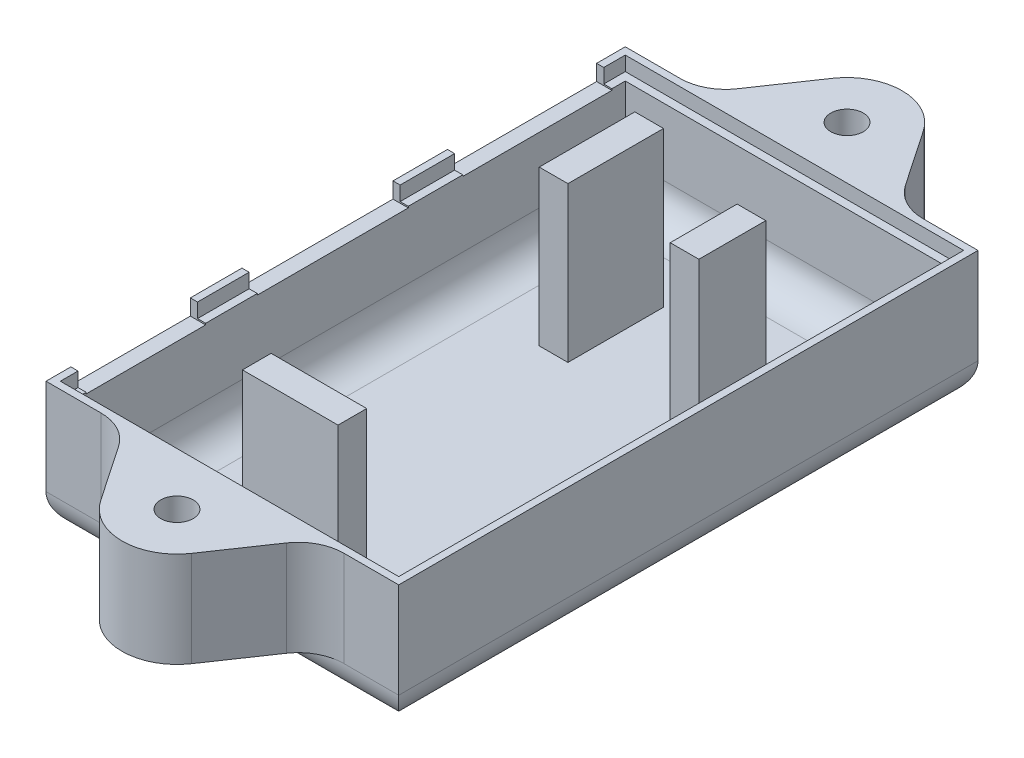
from build123d import *

# Parameters (mm, degrees)
SKETCH_2_W                  = 36.9
SKETCH_2_H                  = 60.6
SKETCH_2_W_2                = 33.7
SKETCH_2_H_2                = 57.4
SKETCH_2_W_3                = 35.4
SKETCH_2_H_3                = 59.1
SKETCH_2_R                  = 3.75
SKETCH_2_R_2                = 2.25
SKETCH_2_R_3                = 0.75
EXTRUDE_1_DEPTH             = 1.5
EXTRUDE_START               = 1.5
SKETCH_2_20_W               = 36.9
SKETCH_2_20_H               = 60.6
SKETCH_2_20_W_2             = 35.4
SKETCH_2_20_H_2             = 59.1
SKETCH_2_20_W_3             = 33.7
SKETCH_2_20_H_3             = 57.4
EXTRUDE_9_DEPTH             = 12
CUT_EXTRUDE_START           = 13.5
SKETCH_2_21_W               = 35.4
SKETCH_2_21_H               = 59.1
SKETCH_2_21_W_2             = 33.7
SKETCH_2_21_H_2             = 57.4
CUT_EXTRUDE_3_DEPTH         = 1.5
EXTRUDE_START_2             = 13.5
SKETCH_2_23_R               = 3
SKETCH_2_23_R_2             = 1.6
EXTRUDE_10_DEPTH            = 10
FILLET_2_R                  = 3.5
HOLE_WIZARD_M32_D           = 3.4
HOLE_WIZARD_M32_CSINK_D     = 6.72
HOLE_WIZARD_M32_CSINK_ANGLE = 90
SKETCH_12_W                 = 1.6
SKETCH_12_H                 = 15.6
SKETCH_12_H_2               = 15.8
SKETCH_12_H_3               = 12.5
CUT_EXTRUDE_4_DEPTH         = 1.65
SKETCH_13_W                 = 3
SKETCH_13_H                 = 10
SKETCH_13_H_2               = 7
SKETCH_13_W_2               = 10
SKETCH_13_H_3               = 3
EXTRUDE_11_DEPTH            = 16.2


with BuildPart() as part:
    # Эскиз2 → Бобышка-Вытянуть1 (new body)
    # profile 1 of 15: a face of its own
    with BuildSketch(Plane(origin=(0, 0, 0), x_dir=(1, 0, 0), z_dir=(0, 1, 0))):
        with Locations((16.65, 28.5)):
            Rectangle(SKETCH_2_W, SKETCH_2_H)
        with Locations((16.65, 28.5)):
            Rectangle(SKETCH_2_W_2, SKETCH_2_H_2, mode=Mode.SUBTRACT)
    # profile 2 of 15: a face of its own
    with BuildSketch(Plane(origin=(0, 0, 0), x_dir=(1, 0, 0), z_dir=(0, 1, 0))):
        with Locations((16.65, 28.5)):
            Rectangle(SKETCH_2_W_3, SKETCH_2_H_3)
        with Locations((16.65, 28.5)):
            Rectangle(SKETCH_2_W_2, SKETCH_2_H_2, mode=Mode.SUBTRACT)
    # profile 3 of 15: a face of its own
    with BuildSketch(Plane(origin=(0, 0, 0), x_dir=(1, 0, 0), z_dir=(0, 1, 0))):
        with BuildLine():
            Line((-0.2, 57.2), (-0.2, -0.2))
            Line((-0.2, -0.2), (33.5, -0.2))
            Line((33.5, -0.2), (33.5, 10.050490243))
            ThreePointArc((33.5, 10.050490243), (27, 12.6), (33.5, 15.149509757))
            Line((33.5, 15.149509757), (33.5, 57.2))
            Line((33.5, 57.2), (-0.2, 57.2))
        make_face()
        with Locations((5.1, 19.73)):
            Circle(SKETCH_2_R, mode=Mode.SUBTRACT)
        with Locations((5.1, 41.13)):
            Circle(SKETCH_2_R, mode=Mode.SUBTRACT)
        with Locations((23.55, 45)):
            Circle(SKETCH_2_R, mode=Mode.SUBTRACT)
    # profile 4 of 15: a face of its own
    with BuildSketch(Plane(origin=(0, 0, 0), x_dir=(1, 0, 0), z_dir=(0, 1, 0))):
        with Locations((23.55, 45)):
            Circle(SKETCH_2_R)
        with Locations((23.55, 45)):
            Circle(SKETCH_2_R_2, mode=Mode.SUBTRACT)
    # profile 5 of 15: a face of its own
    with BuildSketch(Plane(origin=(0, 0, 0), x_dir=(1, 0, 0), z_dir=(0, 1, 0))):
        with Locations((23.55, 45)):
            Circle(SKETCH_2_R_2)
        with Locations((23.55, 45)):
            Circle(SKETCH_2_R_3, mode=Mode.SUBTRACT)
    # profile 6 of 15: a face of its own
    with BuildSketch(Plane(origin=(0, 0, 0), x_dir=(1, 0, 0), z_dir=(0, 1, 0))):
        with Locations((23.55, 45)):
            Circle(SKETCH_2_R_3)
    # profile 7 of 15: a face of its own
    with BuildSketch(Plane(origin=(0, 0, 0), x_dir=(1, 0, 0), z_dir=(0, 1, 0))):
        with Locations((5.1, 41.13)):
            Circle(SKETCH_2_R)
        with Locations((5.1, 41.13)):
            Circle(SKETCH_2_R_2, mode=Mode.SUBTRACT)
    # profile 8 of 15: a face of its own
    with BuildSketch(Plane(origin=(0, 0, 0), x_dir=(1, 0, 0), z_dir=(0, 1, 0))):
        with Locations((5.1, 41.13)):
            Circle(SKETCH_2_R_2)
        with Locations((5.1, 41.13)):
            Circle(SKETCH_2_R_3, mode=Mode.SUBTRACT)
    # profile 9 of 15: a face of its own
    with BuildSketch(Plane(origin=(0, 0, 0), x_dir=(1, 0, 0), z_dir=(0, 1, 0))):
        with Locations((5.1, 41.13)):
            Circle(SKETCH_2_R_3)
    # profile 10 of 15: a face of its own
    with BuildSketch(Plane(origin=(0, 0, 0), x_dir=(1, 0, 0), z_dir=(0, 1, 0))):
        with Locations((5.1, 19.73)):
            Circle(SKETCH_2_R)
        with Locations((5.1, 19.73)):
            Circle(SKETCH_2_R_2, mode=Mode.SUBTRACT)
    # profile 11 of 15: a face of its own
    with BuildSketch(Plane(origin=(0, 0, 0), x_dir=(1, 0, 0), z_dir=(0, 1, 0))):
        with Locations((5.1, 19.73)):
            Circle(SKETCH_2_R_2)
        with Locations((5.1, 19.73)):
            Circle(SKETCH_2_R_3, mode=Mode.SUBTRACT)
    # profile 12 of 15: a face of its own
    with BuildSketch(Plane(origin=(0, 0, 0), x_dir=(1, 0, 0), z_dir=(0, 1, 0))):
        with Locations((5.1, 19.73)):
            Circle(SKETCH_2_R_3)
    # profile 13 of 15: a face of its own
    with BuildSketch(Plane(origin=(0, 0, 0), x_dir=(1, 0, 0), z_dir=(0, 1, 0))):
        with BuildLine():
            ThreePointArc((33.5, 15.149509757), (27, 12.6), (33.5, 10.050490243))
            Line((33.5, 10.050490243), (33.5, 15.149509757))
        make_face()
        with Locations((30.75, 12.6)):
            Circle(SKETCH_2_R_2, mode=Mode.SUBTRACT)
    # profile 14 of 15: a face of its own
    with BuildSketch(Plane(origin=(0, 0, 0), x_dir=(1, 0, 0), z_dir=(0, 1, 0))):
        with Locations((30.75, 12.6)):
            Circle(SKETCH_2_R_2)
        with Locations((30.75, 12.6)):
            Circle(SKETCH_2_R_3, mode=Mode.SUBTRACT)
    # profile 15 of 15: a face of its own
    with BuildSketch(Plane(origin=(0, 0, 0), x_dir=(1, 0, 0), z_dir=(0, 1, 0))):
        with Locations((30.75, 12.6)):
            Circle(SKETCH_2_R_3)
    extrude(amount=EXTRUDE_1_DEPTH)

    # Эскиз2<20> → Бобышка-Вытянуть9 (add)
    # profile 1 of 2: a face of its own
    with BuildSketch(Plane(origin=(0, 0, 0), x_dir=(1, 0, 0), z_dir=(0, 1, 0)).offset(EXTRUDE_START)):
        with Locations((16.65, 28.5)):
            Rectangle(SKETCH_2_20_W, SKETCH_2_20_H)
        with Locations((16.65, 28.5)):
            Rectangle(SKETCH_2_20_W_2, SKETCH_2_20_H_2, mode=Mode.SUBTRACT)
    # profile 2 of 2: a face of its own
    with BuildSketch(Plane(origin=(0, 0, 0), x_dir=(1, 0, 0), z_dir=(0, 1, 0)).offset(EXTRUDE_START)):
        with Locations((16.65, 28.5)):
            Rectangle(SKETCH_2_20_W_2, SKETCH_2_20_H_2)
        with Locations((16.65, 28.5)):
            Rectangle(SKETCH_2_20_W_3, SKETCH_2_20_H_3, mode=Mode.SUBTRACT)
    extrude(amount=EXTRUDE_9_DEPTH)

    # Эскиз2<21> → Вырез-Вытянуть3 (cut)
    with BuildSketch(Plane(origin=(0, 0, 0), x_dir=(1, 0, 0), z_dir=(0, 1, 0)).offset(CUT_EXTRUDE_START)):
        with Locations((16.65, 28.5)):
            Rectangle(SKETCH_2_21_W, SKETCH_2_21_H)
        with Locations((16.65, 28.5)):
            Rectangle(SKETCH_2_21_W_2, SKETCH_2_21_H_2, mode=Mode.SUBTRACT)
    extrude(amount=-CUT_EXTRUDE_3_DEPTH, mode=Mode.SUBTRACT)

    # Эскиз2<23> → Бобышка-Вытянуть10 (add)
    # profile 1 of 4: a face of its own
    with BuildSketch(Plane(origin=(0, 0, 0), x_dir=(1, 0, 0), z_dir=(0, 1, 0)).offset(EXTRUDE_START_2)):
        with BuildLine():
            ThreePointArc((7.877165354, 60.877946056), (6.171513422, 59.351502874), (3.95, 58.8))
            Line((3.95, 58.8), (29.35, 58.8))
            ThreePointArc((29.35, 58.8), (27.128486578, 59.351502874), (25.422834646, 60.877946056))
            Line((25.422834646, 60.877946056), (21.403937008, 66.784591616))
            ThreePointArc((21.403937008, 66.784591616), (19.339200458, 68.632391258), (16.65, 69.3))
            ThreePointArc((16.65, 69.3), (13.960799542, 68.632391258), (11.896062992, 66.784591616))
            Line((11.896062992, 66.784591616), (7.877165354, 60.877946056))
        make_face()
        with Locations((16.65, 63.55)):
            Circle(SKETCH_2_23_R, mode=Mode.SUBTRACT)
    # profile 2 of 4: a face of its own
    with BuildSketch(Plane(origin=(0, 0, 0), x_dir=(1, 0, 0), z_dir=(0, 1, 0)).offset(EXTRUDE_START_2)):
        with Locations((16.65, 63.55)):
            Circle(SKETCH_2_23_R)
        with Locations(Location((16.65, 63.55, 0), (0, 0, 90))):
            Circle(SKETCH_2_23_R_2, mode=Mode.SUBTRACT)
    # profile 3 of 4: a face of its own
    with BuildSketch(Plane(origin=(0, 0, 0), x_dir=(1, 0, 0), z_dir=(0, 1, 0)).offset(EXTRUDE_START_2)):
        with BuildLine():
            Line((29.35, -1.8), (3.95, -1.8))
            ThreePointArc((3.95, -1.8), (6.171513422, -2.351502874), (7.877165354, -3.877946056))
            Line((7.877165354, -3.877946056), (11.896062992, -9.784591616))
            ThreePointArc((11.896062992, -9.784591616), (13.960799542, -11.632391258), (16.65, -12.3))
            ThreePointArc((16.65, -12.3), (19.339200458, -11.632391258), (21.403937008, -9.784591616))
            Line((21.403937008, -9.784591616), (25.422834646, -3.877946056))
            ThreePointArc((25.422834646, -3.877946056), (27.128486578, -2.351502874), (29.35, -1.8))
        make_face()
        with Locations((16.65, -6.55)):
            Circle(SKETCH_2_23_R, mode=Mode.SUBTRACT)
    # profile 4 of 4: a face of its own
    with BuildSketch(Plane(origin=(0, 0, 0), x_dir=(1, 0, 0), z_dir=(0, 1, 0)).offset(EXTRUDE_START_2)):
        with Locations((16.65, -6.55)):
            Circle(SKETCH_2_23_R)
        with Locations(Location((16.65, -6.55, 0), (0, 0, 90))):
            Circle(SKETCH_2_23_R_2, mode=Mode.SUBTRACT)
    extrude(amount=-EXTRUDE_10_DEPTH)

    # Скругление2
    fillet_2_edges = [part.edges().sort_by_distance(p)[0] for p in [
        (16.65, 1.5, -57.2),
        (-0.2, 1.5, -28.5),
        (33.5, 1.5, -28.5),
        (16.65, 1.5, 0.2),
        (16.65, 0, -58.8),
        (35.1, 0, -28.5),
        (16.65, 0, 1.8),
        (-1.8, 0, -28.5),
    ]]
    fillet(fillet_2_edges, radius=FILLET_2_R - 0.0001)  # a hair under: the kernel refuses the full size

    # Зенковка для  винта с потайной головкой с внутренним шестигранником M32 (through all)
    with Locations(Plane(origin=(0, 3.5, 0), x_dir=(-1, 0, 0), z_dir=(0, -1, 0))):
        with Locations((-16.65, 63.55), (-16.65, -6.55)):
            CounterSinkHole(HOLE_WIZARD_M32_D / 2, HOLE_WIZARD_M32_CSINK_D / 2, counter_sink_angle=HOLE_WIZARD_M32_CSINK_ANGLE)

    # Эскиз12 → Вырез-Вытянуть4 (cut)
    with BuildSketch(Plane(origin=(0, 13.5, 0), x_dir=(1, 0, 0), z_dir=(0, 1, 0))):
        with Locations((-1, 48)):
            Rectangle(SKETCH_12_W, SKETCH_12_H)
        with Locations((-1, 26.6)):
            Rectangle(SKETCH_12_W, SKETCH_12_H_2)
        with Locations((-1, 7.05)):
            Rectangle(SKETCH_12_W, SKETCH_12_H_3)
    extrude(amount=-CUT_EXTRUDE_4_DEPTH, mode=Mode.SUBTRACT)

    # Эскиз13 → Бобышка-Вытянуть11 (add)
    with BuildSketch(Plane(origin=(0, 1.5, 0), x_dir=(1, 0, 0), z_dir=(0, 1, 0))):
        with Locations((10.3, 44.2)):
            Rectangle(SKETCH_13_W, SKETCH_13_H)
        with Locations((24, 42.7)):
            Rectangle(SKETCH_13_W, SKETCH_13_H_2)
        with Locations((16.65, 6.8)):
            Rectangle(SKETCH_13_W_2, SKETCH_13_H_3)
    extrude(amount=EXTRUDE_11_DEPTH)


solid = part.part
